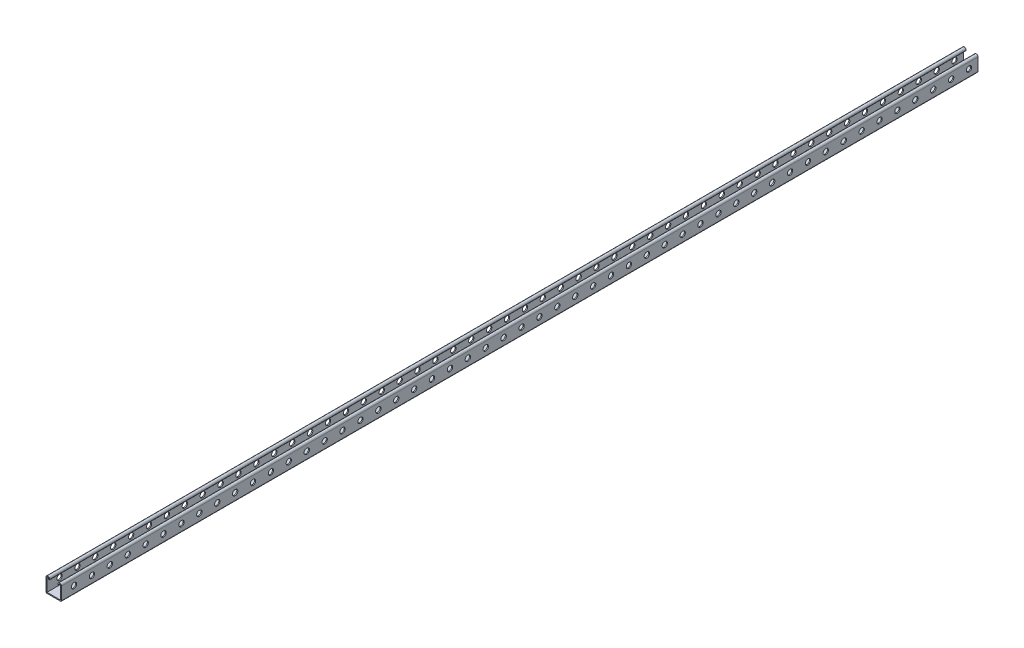
from build123d import *

# Parameters (mm, degrees)
BASE_EXTRUDE_DEPTH                         = 2438.4
HOLE1_START                                = -20.6375
HOLE1_OUTLINE_R                            = 7.14375
HOLE1_DEPTH                                = 2.6924
LPATTERN1_COUNT                            = 51
LPATTERN1_PITCH                            = 47.625
CIRPATTERN1_COUNT                          = 2
CIRPATTERN1_ANGLE                          = 90
CIRPATTERN1_START                          = -20.6375
CIRPATTERN1_COPY_1_SKETCH_R                = 7.14375
CIRPATTERN1_COPY_1_DEPTH                   = 2.6924
CIRPATTERN1_COPY_2_SKETCH_R                = 7.14375
CIRPATTERN1_COPY_2_DEPTH                   = 2.6924
CIRPATTERN1_COPY_3_SKETCH_R                = 7.14375
CIRPATTERN1_COPY_3_DEPTH                   = 2.6924
CIRPATTERN1_COPY_4_SKETCH_R                = 7.14375
CIRPATTERN1_COPY_4_DEPTH                   = 2.6924
CIRPATTERN1_COPY_5_SKETCH_R                = 7.14375
CIRPATTERN1_COPY_5_DEPTH                   = 2.6924
CIRPATTERN1_COPY_6_SKETCH_R                = 7.14375
CIRPATTERN1_COPY_6_DEPTH                   = 2.6924
CIRPATTERN1_COPY_7_SKETCH_R                = 7.14375
CIRPATTERN1_COPY_7_DEPTH                   = 2.6924
CIRPATTERN1_COPY_8_SKETCH_R                = 7.14375
CIRPATTERN1_COPY_8_DEPTH                   = 2.6924
CIRPATTERN1_COPY_9_SKETCH_R                = 7.14375
CIRPATTERN1_COPY_9_DEPTH                   = 2.6924
CIRPATTERN1_COPY_10_SKETCH_R               = 7.14375
CIRPATTERN1_COPY_10_DEPTH                  = 2.6924
CIRPATTERN1_COPY_11_SKETCH_R               = 7.14375
CIRPATTERN1_COPY_11_DEPTH                  = 2.6924
CIRPATTERN1_COPY_12_SKETCH_R               = 7.14375
CIRPATTERN1_COPY_12_DEPTH                  = 2.6924
CIRPATTERN1_COPY_13_SKETCH_R               = 7.14375
CIRPATTERN1_COPY_13_DEPTH                  = 2.6924
CIRPATTERN1_COPY_14_SKETCH_R               = 7.14375
CIRPATTERN1_COPY_14_DEPTH                  = 2.6924
CIRPATTERN1_COPY_15_SKETCH_R               = 7.14375
CIRPATTERN1_COPY_15_DEPTH                  = 2.6924
CIRPATTERN1_COPY_16_SKETCH_R               = 7.14375
CIRPATTERN1_COPY_16_DEPTH                  = 2.6924
CIRPATTERN1_COPY_17_SKETCH_R               = 7.14375
CIRPATTERN1_COPY_17_DEPTH                  = 2.6924
CIRPATTERN1_COPY_18_SKETCH_R               = 7.14375
CIRPATTERN1_COPY_18_DEPTH                  = 2.6924
CIRPATTERN1_COPY_19_SKETCH_R               = 7.14375
CIRPATTERN1_COPY_19_DEPTH                  = 2.6924
CIRPATTERN1_COPY_20_SKETCH_R               = 7.14375
CIRPATTERN1_COPY_20_DEPTH                  = 2.6924
CIRPATTERN1_COPY_21_SKETCH_R               = 7.14375
CIRPATTERN1_COPY_21_DEPTH                  = 2.6924
CIRPATTERN1_COPY_22_SKETCH_R               = 7.14375
CIRPATTERN1_COPY_22_DEPTH                  = 2.6924
CIRPATTERN1_COPY_23_SKETCH_R               = 7.14375
CIRPATTERN1_COPY_23_DEPTH                  = 2.6924
CIRPATTERN1_COPY_24_SKETCH_R               = 7.14375
CIRPATTERN1_COPY_24_DEPTH                  = 2.6924
CIRPATTERN1_COPY_25_SKETCH_R               = 7.14375
CIRPATTERN1_COPY_25_DEPTH                  = 2.6924
CIRPATTERN1_COPY_26_SKETCH_R               = 7.14375
CIRPATTERN1_COPY_26_DEPTH                  = 2.6924
CIRPATTERN1_COPY_27_SKETCH_R               = 7.14375
CIRPATTERN1_COPY_27_DEPTH                  = 2.6924
CIRPATTERN1_COPY_28_SKETCH_R               = 7.14375
CIRPATTERN1_COPY_28_DEPTH                  = 2.6924
CIRPATTERN1_COPY_29_SKETCH_R               = 7.14375
CIRPATTERN1_COPY_29_DEPTH                  = 2.6924
CIRPATTERN1_COPY_30_SKETCH_R               = 7.14375
CIRPATTERN1_COPY_30_DEPTH                  = 2.6924
CIRPATTERN1_COPY_31_SKETCH_R               = 7.14375
CIRPATTERN1_COPY_31_DEPTH                  = 2.6924
CIRPATTERN1_COPY_32_SKETCH_R               = 7.14375
CIRPATTERN1_COPY_32_DEPTH                  = 2.6924
CIRPATTERN1_COPY_33_SKETCH_R               = 7.14375
CIRPATTERN1_COPY_33_DEPTH                  = 2.6924
CIRPATTERN1_COPY_34_SKETCH_R               = 7.14375
CIRPATTERN1_COPY_34_DEPTH                  = 2.6924
CIRPATTERN1_COPY_35_SKETCH_R               = 7.14375
CIRPATTERN1_COPY_35_DEPTH                  = 2.6924
CIRPATTERN1_COPY_36_SKETCH_R               = 7.14375
CIRPATTERN1_COPY_36_DEPTH                  = 2.6924
CIRPATTERN1_COPY_37_SKETCH_R               = 7.14375
CIRPATTERN1_COPY_37_DEPTH                  = 2.6924
CIRPATTERN1_COPY_38_SKETCH_R               = 7.14375
CIRPATTERN1_COPY_38_DEPTH                  = 2.6924
CIRPATTERN1_COPY_39_SKETCH_R               = 7.14375
CIRPATTERN1_COPY_39_DEPTH                  = 2.6924
CIRPATTERN1_COPY_40_SKETCH_R               = 7.14375
CIRPATTERN1_COPY_40_DEPTH                  = 2.6924
CIRPATTERN1_COPY_41_SKETCH_R               = 7.14375
CIRPATTERN1_COPY_41_DEPTH                  = 2.6924
CIRPATTERN1_COPY_42_SKETCH_R               = 7.14375
CIRPATTERN1_COPY_42_DEPTH                  = 2.6924
CIRPATTERN1_COPY_43_SKETCH_R               = 7.14375
CIRPATTERN1_COPY_43_DEPTH                  = 2.6924
CIRPATTERN1_COPY_44_SKETCH_R               = 7.14375
CIRPATTERN1_COPY_44_DEPTH                  = 2.6924
CIRPATTERN1_COPY_45_SKETCH_R               = 7.14375
CIRPATTERN1_COPY_45_DEPTH                  = 2.6924
CIRPATTERN1_COPY_46_SKETCH_R               = 7.14375
CIRPATTERN1_COPY_46_DEPTH                  = 2.6924
CIRPATTERN1_COPY_47_SKETCH_R               = 7.14375
CIRPATTERN1_COPY_47_DEPTH                  = 2.6924
CIRPATTERN1_COPY_48_SKETCH_R               = 7.14375
CIRPATTERN1_COPY_48_DEPTH                  = 2.6924
CIRPATTERN1_COPY_49_SKETCH_R               = 7.14375
CIRPATTERN1_COPY_49_DEPTH                  = 2.6924
CIRPATTERN1_COPY_50_SKETCH_R               = 7.14375
CIRPATTERN1_COPY_50_DEPTH                  = 2.6924
CIRPATTERN1_THE_OTHER_WAY_COUNT            = 2
CIRPATTERN1_THE_OTHER_WAY_ANGLE            = 90
CIRPATTERN1_THE_OTHER_WAY_COPY_1_SKETCH_R  = 7.14375
CIRPATTERN1_THE_OTHER_WAY_COPY_1_DEPTH     = 2.6924
CIRPATTERN1_THE_OTHER_WAY_COPY_2_SKETCH_R  = 7.14375
CIRPATTERN1_THE_OTHER_WAY_COPY_2_DEPTH     = 2.6924
CIRPATTERN1_THE_OTHER_WAY_COPY_3_SKETCH_R  = 7.14375
CIRPATTERN1_THE_OTHER_WAY_COPY_3_DEPTH     = 2.6924
CIRPATTERN1_THE_OTHER_WAY_COPY_4_SKETCH_R  = 7.14375
CIRPATTERN1_THE_OTHER_WAY_COPY_4_DEPTH     = 2.6924
CIRPATTERN1_THE_OTHER_WAY_COPY_5_SKETCH_R  = 7.14375
CIRPATTERN1_THE_OTHER_WAY_COPY_5_DEPTH     = 2.6924
CIRPATTERN1_THE_OTHER_WAY_COPY_6_SKETCH_R  = 7.14375
CIRPATTERN1_THE_OTHER_WAY_COPY_6_DEPTH     = 2.6924
CIRPATTERN1_THE_OTHER_WAY_COPY_7_SKETCH_R  = 7.14375
CIRPATTERN1_THE_OTHER_WAY_COPY_7_DEPTH     = 2.6924
CIRPATTERN1_THE_OTHER_WAY_COPY_8_SKETCH_R  = 7.14375
CIRPATTERN1_THE_OTHER_WAY_COPY_8_DEPTH     = 2.6924
CIRPATTERN1_THE_OTHER_WAY_COPY_9_SKETCH_R  = 7.14375
CIRPATTERN1_THE_OTHER_WAY_COPY_9_DEPTH     = 2.6924
CIRPATTERN1_THE_OTHER_WAY_COPY_10_SKETCH_R = 7.14375
CIRPATTERN1_THE_OTHER_WAY_COPY_10_DEPTH    = 2.6924
CIRPATTERN1_THE_OTHER_WAY_COPY_11_SKETCH_R = 7.14375
CIRPATTERN1_THE_OTHER_WAY_COPY_11_DEPTH    = 2.6924
CIRPATTERN1_THE_OTHER_WAY_COPY_12_SKETCH_R = 7.14375
CIRPATTERN1_THE_OTHER_WAY_COPY_12_DEPTH    = 2.6924
CIRPATTERN1_THE_OTHER_WAY_COPY_13_SKETCH_R = 7.14375
CIRPATTERN1_THE_OTHER_WAY_COPY_13_DEPTH    = 2.6924
CIRPATTERN1_THE_OTHER_WAY_COPY_14_SKETCH_R = 7.14375
CIRPATTERN1_THE_OTHER_WAY_COPY_14_DEPTH    = 2.6924
CIRPATTERN1_THE_OTHER_WAY_COPY_15_SKETCH_R = 7.14375
CIRPATTERN1_THE_OTHER_WAY_COPY_15_DEPTH    = 2.6924
CIRPATTERN1_THE_OTHER_WAY_COPY_16_SKETCH_R = 7.14375
CIRPATTERN1_THE_OTHER_WAY_COPY_16_DEPTH    = 2.6924
CIRPATTERN1_THE_OTHER_WAY_COPY_17_SKETCH_R = 7.14375
CIRPATTERN1_THE_OTHER_WAY_COPY_17_DEPTH    = 2.6924
CIRPATTERN1_THE_OTHER_WAY_COPY_18_SKETCH_R = 7.14375
CIRPATTERN1_THE_OTHER_WAY_COPY_18_DEPTH    = 2.6924
CIRPATTERN1_THE_OTHER_WAY_COPY_19_SKETCH_R = 7.14375
CIRPATTERN1_THE_OTHER_WAY_COPY_19_DEPTH    = 2.6924
CIRPATTERN1_THE_OTHER_WAY_COPY_20_SKETCH_R = 7.14375
CIRPATTERN1_THE_OTHER_WAY_COPY_20_DEPTH    = 2.6924
CIRPATTERN1_THE_OTHER_WAY_COPY_21_SKETCH_R = 7.14375
CIRPATTERN1_THE_OTHER_WAY_COPY_21_DEPTH    = 2.6924
CIRPATTERN1_THE_OTHER_WAY_COPY_22_SKETCH_R = 7.14375
CIRPATTERN1_THE_OTHER_WAY_COPY_22_DEPTH    = 2.6924
CIRPATTERN1_THE_OTHER_WAY_COPY_23_SKETCH_R = 7.14375
CIRPATTERN1_THE_OTHER_WAY_COPY_23_DEPTH    = 2.6924
CIRPATTERN1_THE_OTHER_WAY_COPY_24_SKETCH_R = 7.14375
CIRPATTERN1_THE_OTHER_WAY_COPY_24_DEPTH    = 2.6924
CIRPATTERN1_THE_OTHER_WAY_COPY_25_SKETCH_R = 7.14375
CIRPATTERN1_THE_OTHER_WAY_COPY_25_DEPTH    = 2.6924
CIRPATTERN1_THE_OTHER_WAY_COPY_26_SKETCH_R = 7.14375
CIRPATTERN1_THE_OTHER_WAY_COPY_26_DEPTH    = 2.6924
CIRPATTERN1_THE_OTHER_WAY_COPY_27_SKETCH_R = 7.14375
CIRPATTERN1_THE_OTHER_WAY_COPY_27_DEPTH    = 2.6924
CIRPATTERN1_THE_OTHER_WAY_COPY_28_SKETCH_R = 7.14375
CIRPATTERN1_THE_OTHER_WAY_COPY_28_DEPTH    = 2.6924
CIRPATTERN1_THE_OTHER_WAY_COPY_29_SKETCH_R = 7.14375
CIRPATTERN1_THE_OTHER_WAY_COPY_29_DEPTH    = 2.6924
CIRPATTERN1_THE_OTHER_WAY_COPY_30_SKETCH_R = 7.14375
CIRPATTERN1_THE_OTHER_WAY_COPY_30_DEPTH    = 2.6924
CIRPATTERN1_THE_OTHER_WAY_COPY_31_SKETCH_R = 7.14375
CIRPATTERN1_THE_OTHER_WAY_COPY_31_DEPTH    = 2.6924
CIRPATTERN1_THE_OTHER_WAY_COPY_32_SKETCH_R = 7.14375
CIRPATTERN1_THE_OTHER_WAY_COPY_32_DEPTH    = 2.6924
CIRPATTERN1_THE_OTHER_WAY_COPY_33_SKETCH_R = 7.14375
CIRPATTERN1_THE_OTHER_WAY_COPY_33_DEPTH    = 2.6924
CIRPATTERN1_THE_OTHER_WAY_COPY_34_SKETCH_R = 7.14375
CIRPATTERN1_THE_OTHER_WAY_COPY_34_DEPTH    = 2.6924
CIRPATTERN1_THE_OTHER_WAY_COPY_35_SKETCH_R = 7.14375
CIRPATTERN1_THE_OTHER_WAY_COPY_35_DEPTH    = 2.6924
CIRPATTERN1_THE_OTHER_WAY_COPY_36_SKETCH_R = 7.14375
CIRPATTERN1_THE_OTHER_WAY_COPY_36_DEPTH    = 2.6924
CIRPATTERN1_THE_OTHER_WAY_COPY_37_SKETCH_R = 7.14375
CIRPATTERN1_THE_OTHER_WAY_COPY_37_DEPTH    = 2.6924
CIRPATTERN1_THE_OTHER_WAY_COPY_38_SKETCH_R = 7.14375
CIRPATTERN1_THE_OTHER_WAY_COPY_38_DEPTH    = 2.6924
CIRPATTERN1_THE_OTHER_WAY_COPY_39_SKETCH_R = 7.14375
CIRPATTERN1_THE_OTHER_WAY_COPY_39_DEPTH    = 2.6924
CIRPATTERN1_THE_OTHER_WAY_COPY_40_SKETCH_R = 7.14375
CIRPATTERN1_THE_OTHER_WAY_COPY_40_DEPTH    = 2.6924
CIRPATTERN1_THE_OTHER_WAY_COPY_41_SKETCH_R = 7.14375
CIRPATTERN1_THE_OTHER_WAY_COPY_41_DEPTH    = 2.6924
CIRPATTERN1_THE_OTHER_WAY_COPY_42_SKETCH_R = 7.14375
CIRPATTERN1_THE_OTHER_WAY_COPY_42_DEPTH    = 2.6924
CIRPATTERN1_THE_OTHER_WAY_COPY_43_SKETCH_R = 7.14375
CIRPATTERN1_THE_OTHER_WAY_COPY_43_DEPTH    = 2.6924
CIRPATTERN1_THE_OTHER_WAY_COPY_44_SKETCH_R = 7.14375
CIRPATTERN1_THE_OTHER_WAY_COPY_44_DEPTH    = 2.6924
CIRPATTERN1_THE_OTHER_WAY_COPY_45_SKETCH_R = 7.14375
CIRPATTERN1_THE_OTHER_WAY_COPY_45_DEPTH    = 2.6924
CIRPATTERN1_THE_OTHER_WAY_COPY_46_SKETCH_R = 7.14375
CIRPATTERN1_THE_OTHER_WAY_COPY_46_DEPTH    = 2.6924
CIRPATTERN1_THE_OTHER_WAY_COPY_47_SKETCH_R = 7.14375
CIRPATTERN1_THE_OTHER_WAY_COPY_47_DEPTH    = 2.6924
CIRPATTERN1_THE_OTHER_WAY_COPY_48_SKETCH_R = 7.14375
CIRPATTERN1_THE_OTHER_WAY_COPY_48_DEPTH    = 2.6924
CIRPATTERN1_THE_OTHER_WAY_COPY_49_SKETCH_R = 7.14375
CIRPATTERN1_THE_OTHER_WAY_COPY_49_DEPTH    = 2.6924
CIRPATTERN1_THE_OTHER_WAY_COPY_50_SKETCH_R = 7.14375
CIRPATTERN1_THE_OTHER_WAY_COPY_50_DEPTH    = 2.6924


# Read off the part's stored shape, not the designer's step: Hole1
with BuildPart() as part:
    # Sketch1 → Base-Extrude (new body)
    with BuildSketch(Plane.XY):
        with BuildLine():
            Line((-20.6375, 15.875), (-20.6375, -17.9451))
            ThreePointArc((-20.6375, -17.9451), (-19.848914298, -19.848914298), (-17.9451, -20.6375))
            Line((-17.9451, -20.6375), (17.9451, -20.6375))
            ThreePointArc((17.9451, -20.6375), (19.848914298, -19.848914298), (20.6375, -17.9451))
            Line((20.6375, -17.9451), (20.6375, 15.875))
            ThreePointArc((20.6375, 15.875), (15.875, 20.6375), (11.1125, 15.875))
            Line((11.1125, 15.875), (11.1125, 14.83995))
            ThreePointArc((11.1125, 14.83995), (12.4587, 13.49375), (13.8049, 14.83995))
            Line((13.8049, 14.83995), (13.8049, 15.875))
            ThreePointArc((13.8049, 15.875), (15.875, 17.9451), (17.9451, 15.875))
            Line((17.9451, 15.875), (17.9451, -17.9451))
            Line((17.9451, -17.9451), (-17.9451, -17.9451))
            Line((-17.9451, -17.9451), (-17.9451, 15.875))
            ThreePointArc((-17.9451, 15.875), (-15.875, 17.9451), (-13.8049, 15.875))
            Line((-13.8049, 15.875), (-13.8049, 14.83995))
            ThreePointArc((-13.8049, 14.83995), (-12.4587, 13.49375), (-11.1125, 14.83995))
            Line((-11.1125, 14.83995), (-11.1125, 15.875))
            ThreePointArc((-11.1125, 15.875), (-15.875, 20.6375), (-20.6375, 15.875))
        make_face()
    extrude(amount=BASE_EXTRUDE_DEPTH)

    # Hole1 outline → Hole1 (cut)
    with BuildSketch(Plane(origin=(0, 0, 0), x_dir=(1, 0, 0), z_dir=(0, 1, 0)).offset(HOLE1_START)):
        with Locations((0, -23.8125)):
            Circle(HOLE1_OUTLINE_R)
    hole1 = extrude(amount=HOLE1_DEPTH, mode=Mode.SUBTRACT)

    # LPattern1: Hole1 ×51
    with Locations(*[(0, 0, i * LPATTERN1_PITCH) for i in range(1, LPATTERN1_COUNT)]):
        add(hole1, mode=Mode.SUBTRACT)

    # CirPattern1: Hole1 ×2 about axis
    cirpattern1_axis = Axis((0, 0, -50), (0, 0, 1))
    for i in range(1, CIRPATTERN1_COUNT):
        add(hole1.rotate(cirpattern1_axis, i * CIRPATTERN1_ANGLE / (CIRPATTERN1_COUNT - 1)), mode=Mode.SUBTRACT)

    # CirPattern1 copy 1 sketch → CirPattern1 copy 1 (cut)
    with BuildSketch(Plane(origin=(0, 0, 47.625), x_dir=(0, 1, 0), z_dir=(-1, 0, 0)).offset(CIRPATTERN1_START)):
        with Locations((0, -23.8125)):
            Circle(CIRPATTERN1_COPY_1_SKETCH_R)
    extrude(amount=CIRPATTERN1_COPY_1_DEPTH, mode=Mode.SUBTRACT)

    # CirPattern1 copy 2 sketch → CirPattern1 copy 2 (cut)
    with BuildSketch(Plane(origin=(0, 0, 95.25), x_dir=(0, 1, 0), z_dir=(-1, 0, 0)).offset(CIRPATTERN1_START)):
        with Locations((0, -23.8125)):
            Circle(CIRPATTERN1_COPY_2_SKETCH_R)
    extrude(amount=CIRPATTERN1_COPY_2_DEPTH, mode=Mode.SUBTRACT)

    # CirPattern1 copy 3 sketch → CirPattern1 copy 3 (cut)
    with BuildSketch(Plane(origin=(0, 0, 142.875), x_dir=(0, 1, 0), z_dir=(-1, 0, 0)).offset(CIRPATTERN1_START)):
        with Locations((0, -23.8125)):
            Circle(CIRPATTERN1_COPY_3_SKETCH_R)
    extrude(amount=CIRPATTERN1_COPY_3_DEPTH, mode=Mode.SUBTRACT)

    # CirPattern1 copy 4 sketch → CirPattern1 copy 4 (cut)
    with BuildSketch(Plane(origin=(0, 0, 190.5), x_dir=(0, 1, 0), z_dir=(-1, 0, 0)).offset(CIRPATTERN1_START)):
        with Locations((0, -23.8125)):
            Circle(CIRPATTERN1_COPY_4_SKETCH_R)
    extrude(amount=CIRPATTERN1_COPY_4_DEPTH, mode=Mode.SUBTRACT)

    # CirPattern1 copy 5 sketch → CirPattern1 copy 5 (cut)
    with BuildSketch(Plane(origin=(0, 0, 238.125), x_dir=(0, 1, 0), z_dir=(-1, 0, 0)).offset(CIRPATTERN1_START)):
        with Locations((0, -23.8125)):
            Circle(CIRPATTERN1_COPY_5_SKETCH_R)
    extrude(amount=CIRPATTERN1_COPY_5_DEPTH, mode=Mode.SUBTRACT)

    # CirPattern1 copy 6 sketch → CirPattern1 copy 6 (cut)
    with BuildSketch(Plane(origin=(0, 0, 285.75), x_dir=(0, 1, 0), z_dir=(-1, 0, 0)).offset(CIRPATTERN1_START)):
        with Locations((0, -23.8125)):
            Circle(CIRPATTERN1_COPY_6_SKETCH_R)
    extrude(amount=CIRPATTERN1_COPY_6_DEPTH, mode=Mode.SUBTRACT)

    # CirPattern1 copy 7 sketch → CirPattern1 copy 7 (cut)
    with BuildSketch(Plane(origin=(0, 0, 333.375), x_dir=(0, 1, 0), z_dir=(-1, 0, 0)).offset(CIRPATTERN1_START)):
        with Locations((0, -23.8125)):
            Circle(CIRPATTERN1_COPY_7_SKETCH_R)
    extrude(amount=CIRPATTERN1_COPY_7_DEPTH, mode=Mode.SUBTRACT)

    # CirPattern1 copy 8 sketch → CirPattern1 copy 8 (cut)
    with BuildSketch(Plane(origin=(0, 0, 381), x_dir=(0, 1, 0), z_dir=(-1, 0, 0)).offset(CIRPATTERN1_START)):
        with Locations((0, -23.8125)):
            Circle(CIRPATTERN1_COPY_8_SKETCH_R)
    extrude(amount=CIRPATTERN1_COPY_8_DEPTH, mode=Mode.SUBTRACT)

    # CirPattern1 copy 9 sketch → CirPattern1 copy 9 (cut)
    with BuildSketch(Plane(origin=(0, 0, 428.625), x_dir=(0, 1, 0), z_dir=(-1, 0, 0)).offset(CIRPATTERN1_START)):
        with Locations((0, -23.8125)):
            Circle(CIRPATTERN1_COPY_9_SKETCH_R)
    extrude(amount=CIRPATTERN1_COPY_9_DEPTH, mode=Mode.SUBTRACT)

    # CirPattern1 copy 10 sketch → CirPattern1 copy 10 (cut)
    with BuildSketch(Plane(origin=(0, 0, 476.25), x_dir=(0, 1, 0), z_dir=(-1, 0, 0)).offset(CIRPATTERN1_START)):
        with Locations((0, -23.8125)):
            Circle(CIRPATTERN1_COPY_10_SKETCH_R)
    extrude(amount=CIRPATTERN1_COPY_10_DEPTH, mode=Mode.SUBTRACT)

    # CirPattern1 copy 11 sketch → CirPattern1 copy 11 (cut)
    with BuildSketch(Plane(origin=(0, 0, 523.875), x_dir=(0, 1, 0), z_dir=(-1, 0, 0)).offset(CIRPATTERN1_START)):
        with Locations((0, -23.8125)):
            Circle(CIRPATTERN1_COPY_11_SKETCH_R)
    extrude(amount=CIRPATTERN1_COPY_11_DEPTH, mode=Mode.SUBTRACT)

    # CirPattern1 copy 12 sketch → CirPattern1 copy 12 (cut)
    with BuildSketch(Plane(origin=(0, 0, 571.5), x_dir=(0, 1, 0), z_dir=(-1, 0, 0)).offset(CIRPATTERN1_START)):
        with Locations((0, -23.8125)):
            Circle(CIRPATTERN1_COPY_12_SKETCH_R)
    extrude(amount=CIRPATTERN1_COPY_12_DEPTH, mode=Mode.SUBTRACT)

    # CirPattern1 copy 13 sketch → CirPattern1 copy 13 (cut)
    with BuildSketch(Plane(origin=(0, 0, 619.125), x_dir=(0, 1, 0), z_dir=(-1, 0, 0)).offset(CIRPATTERN1_START)):
        with Locations((0, -23.8125)):
            Circle(CIRPATTERN1_COPY_13_SKETCH_R)
    extrude(amount=CIRPATTERN1_COPY_13_DEPTH, mode=Mode.SUBTRACT)

    # CirPattern1 copy 14 sketch → CirPattern1 copy 14 (cut)
    with BuildSketch(Plane(origin=(0, 0, 666.75), x_dir=(0, 1, 0), z_dir=(-1, 0, 0)).offset(CIRPATTERN1_START)):
        with Locations((0, -23.8125)):
            Circle(CIRPATTERN1_COPY_14_SKETCH_R)
    extrude(amount=CIRPATTERN1_COPY_14_DEPTH, mode=Mode.SUBTRACT)

    # CirPattern1 copy 15 sketch → CirPattern1 copy 15 (cut)
    with BuildSketch(Plane(origin=(0, 0, 714.375), x_dir=(0, 1, 0), z_dir=(-1, 0, 0)).offset(CIRPATTERN1_START)):
        with Locations((0, -23.8125)):
            Circle(CIRPATTERN1_COPY_15_SKETCH_R)
    extrude(amount=CIRPATTERN1_COPY_15_DEPTH, mode=Mode.SUBTRACT)

    # CirPattern1 copy 16 sketch → CirPattern1 copy 16 (cut)
    with BuildSketch(Plane(origin=(0, 0, 762), x_dir=(0, 1, 0), z_dir=(-1, 0, 0)).offset(CIRPATTERN1_START)):
        with Locations((0, -23.8125)):
            Circle(CIRPATTERN1_COPY_16_SKETCH_R)
    extrude(amount=CIRPATTERN1_COPY_16_DEPTH, mode=Mode.SUBTRACT)

    # CirPattern1 copy 17 sketch → CirPattern1 copy 17 (cut)
    with BuildSketch(Plane(origin=(0, 0, 809.625), x_dir=(0, 1, 0), z_dir=(-1, 0, 0)).offset(CIRPATTERN1_START)):
        with Locations((0, -23.8125)):
            Circle(CIRPATTERN1_COPY_17_SKETCH_R)
    extrude(amount=CIRPATTERN1_COPY_17_DEPTH, mode=Mode.SUBTRACT)

    # CirPattern1 copy 18 sketch → CirPattern1 copy 18 (cut)
    with BuildSketch(Plane(origin=(0, 0, 857.25), x_dir=(0, 1, 0), z_dir=(-1, 0, 0)).offset(CIRPATTERN1_START)):
        with Locations((0, -23.8125)):
            Circle(CIRPATTERN1_COPY_18_SKETCH_R)
    extrude(amount=CIRPATTERN1_COPY_18_DEPTH, mode=Mode.SUBTRACT)

    # CirPattern1 copy 19 sketch → CirPattern1 copy 19 (cut)
    with BuildSketch(Plane(origin=(0, 0, 904.875), x_dir=(0, 1, 0), z_dir=(-1, 0, 0)).offset(CIRPATTERN1_START)):
        with Locations((0, -23.8125)):
            Circle(CIRPATTERN1_COPY_19_SKETCH_R)
    extrude(amount=CIRPATTERN1_COPY_19_DEPTH, mode=Mode.SUBTRACT)

    # CirPattern1 copy 20 sketch → CirPattern1 copy 20 (cut)
    with BuildSketch(Plane(origin=(0, 0, 952.5), x_dir=(0, 1, 0), z_dir=(-1, 0, 0)).offset(CIRPATTERN1_START)):
        with Locations((0, -23.8125)):
            Circle(CIRPATTERN1_COPY_20_SKETCH_R)
    extrude(amount=CIRPATTERN1_COPY_20_DEPTH, mode=Mode.SUBTRACT)

    # CirPattern1 copy 21 sketch → CirPattern1 copy 21 (cut)
    with BuildSketch(Plane(origin=(0, 0, 1000.125), x_dir=(0, 1, 0), z_dir=(-1, 0, 0)).offset(CIRPATTERN1_START)):
        with Locations((0, -23.8125)):
            Circle(CIRPATTERN1_COPY_21_SKETCH_R)
    extrude(amount=CIRPATTERN1_COPY_21_DEPTH, mode=Mode.SUBTRACT)

    # CirPattern1 copy 22 sketch → CirPattern1 copy 22 (cut)
    with BuildSketch(Plane(origin=(0, 0, 1047.75), x_dir=(0, 1, 0), z_dir=(-1, 0, 0)).offset(CIRPATTERN1_START)):
        with Locations((0, -23.8125)):
            Circle(CIRPATTERN1_COPY_22_SKETCH_R)
    extrude(amount=CIRPATTERN1_COPY_22_DEPTH, mode=Mode.SUBTRACT)

    # CirPattern1 copy 23 sketch → CirPattern1 copy 23 (cut)
    with BuildSketch(Plane(origin=(0, 0, 1095.375), x_dir=(0, 1, 0), z_dir=(-1, 0, 0)).offset(CIRPATTERN1_START)):
        with Locations((0, -23.8125)):
            Circle(CIRPATTERN1_COPY_23_SKETCH_R)
    extrude(amount=CIRPATTERN1_COPY_23_DEPTH, mode=Mode.SUBTRACT)

    # CirPattern1 copy 24 sketch → CirPattern1 copy 24 (cut)
    with BuildSketch(Plane(origin=(0, 0, 1143), x_dir=(0, 1, 0), z_dir=(-1, 0, 0)).offset(CIRPATTERN1_START)):
        with Locations((0, -23.8125)):
            Circle(CIRPATTERN1_COPY_24_SKETCH_R)
    extrude(amount=CIRPATTERN1_COPY_24_DEPTH, mode=Mode.SUBTRACT)

    # CirPattern1 copy 25 sketch → CirPattern1 copy 25 (cut)
    with BuildSketch(Plane(origin=(0, 0, 1190.625), x_dir=(0, 1, 0), z_dir=(-1, 0, 0)).offset(CIRPATTERN1_START)):
        with Locations((0, -23.8125)):
            Circle(CIRPATTERN1_COPY_25_SKETCH_R)
    extrude(amount=CIRPATTERN1_COPY_25_DEPTH, mode=Mode.SUBTRACT)

    # CirPattern1 copy 26 sketch → CirPattern1 copy 26 (cut)
    with BuildSketch(Plane(origin=(0, 0, 1238.25), x_dir=(0, 1, 0), z_dir=(-1, 0, 0)).offset(CIRPATTERN1_START)):
        with Locations((0, -23.8125)):
            Circle(CIRPATTERN1_COPY_26_SKETCH_R)
    extrude(amount=CIRPATTERN1_COPY_26_DEPTH, mode=Mode.SUBTRACT)

    # CirPattern1 copy 27 sketch → CirPattern1 copy 27 (cut)
    with BuildSketch(Plane(origin=(0, 0, 1285.875), x_dir=(0, 1, 0), z_dir=(-1, 0, 0)).offset(CIRPATTERN1_START)):
        with Locations((0, -23.8125)):
            Circle(CIRPATTERN1_COPY_27_SKETCH_R)
    extrude(amount=CIRPATTERN1_COPY_27_DEPTH, mode=Mode.SUBTRACT)

    # CirPattern1 copy 28 sketch → CirPattern1 copy 28 (cut)
    with BuildSketch(Plane(origin=(0, 0, 1333.5), x_dir=(0, 1, 0), z_dir=(-1, 0, 0)).offset(CIRPATTERN1_START)):
        with Locations((0, -23.8125)):
            Circle(CIRPATTERN1_COPY_28_SKETCH_R)
    extrude(amount=CIRPATTERN1_COPY_28_DEPTH, mode=Mode.SUBTRACT)

    # CirPattern1 copy 29 sketch → CirPattern1 copy 29 (cut)
    with BuildSketch(Plane(origin=(0, 0, 1381.125), x_dir=(0, 1, 0), z_dir=(-1, 0, 0)).offset(CIRPATTERN1_START)):
        with Locations((0, -23.8125)):
            Circle(CIRPATTERN1_COPY_29_SKETCH_R)
    extrude(amount=CIRPATTERN1_COPY_29_DEPTH, mode=Mode.SUBTRACT)

    # CirPattern1 copy 30 sketch → CirPattern1 copy 30 (cut)
    with BuildSketch(Plane(origin=(0, 0, 1428.75), x_dir=(0, 1, 0), z_dir=(-1, 0, 0)).offset(CIRPATTERN1_START)):
        with Locations((0, -23.8125)):
            Circle(CIRPATTERN1_COPY_30_SKETCH_R)
    extrude(amount=CIRPATTERN1_COPY_30_DEPTH, mode=Mode.SUBTRACT)

    # CirPattern1 copy 31 sketch → CirPattern1 copy 31 (cut)
    with BuildSketch(Plane(origin=(0, 0, 1476.375), x_dir=(0, 1, 0), z_dir=(-1, 0, 0)).offset(CIRPATTERN1_START)):
        with Locations((0, -23.8125)):
            Circle(CIRPATTERN1_COPY_31_SKETCH_R)
    extrude(amount=CIRPATTERN1_COPY_31_DEPTH, mode=Mode.SUBTRACT)

    # CirPattern1 copy 32 sketch → CirPattern1 copy 32 (cut)
    with BuildSketch(Plane(origin=(0, 0, 1524), x_dir=(0, 1, 0), z_dir=(-1, 0, 0)).offset(CIRPATTERN1_START)):
        with Locations((0, -23.8125)):
            Circle(CIRPATTERN1_COPY_32_SKETCH_R)
    extrude(amount=CIRPATTERN1_COPY_32_DEPTH, mode=Mode.SUBTRACT)

    # CirPattern1 copy 33 sketch → CirPattern1 copy 33 (cut)
    with BuildSketch(Plane(origin=(0, 0, 1571.625), x_dir=(0, 1, 0), z_dir=(-1, 0, 0)).offset(CIRPATTERN1_START)):
        with Locations((0, -23.8125)):
            Circle(CIRPATTERN1_COPY_33_SKETCH_R)
    extrude(amount=CIRPATTERN1_COPY_33_DEPTH, mode=Mode.SUBTRACT)

    # CirPattern1 copy 34 sketch → CirPattern1 copy 34 (cut)
    with BuildSketch(Plane(origin=(0, 0, 1619.25), x_dir=(0, 1, 0), z_dir=(-1, 0, 0)).offset(CIRPATTERN1_START)):
        with Locations((0, -23.8125)):
            Circle(CIRPATTERN1_COPY_34_SKETCH_R)
    extrude(amount=CIRPATTERN1_COPY_34_DEPTH, mode=Mode.SUBTRACT)

    # CirPattern1 copy 35 sketch → CirPattern1 copy 35 (cut)
    with BuildSketch(Plane(origin=(0, 0, 1666.875), x_dir=(0, 1, 0), z_dir=(-1, 0, 0)).offset(CIRPATTERN1_START)):
        with Locations((0, -23.8125)):
            Circle(CIRPATTERN1_COPY_35_SKETCH_R)
    extrude(amount=CIRPATTERN1_COPY_35_DEPTH, mode=Mode.SUBTRACT)

    # CirPattern1 copy 36 sketch → CirPattern1 copy 36 (cut)
    with BuildSketch(Plane(origin=(0, 0, 1714.5), x_dir=(0, 1, 0), z_dir=(-1, 0, 0)).offset(CIRPATTERN1_START)):
        with Locations((0, -23.8125)):
            Circle(CIRPATTERN1_COPY_36_SKETCH_R)
    extrude(amount=CIRPATTERN1_COPY_36_DEPTH, mode=Mode.SUBTRACT)

    # CirPattern1 copy 37 sketch → CirPattern1 copy 37 (cut)
    with BuildSketch(Plane(origin=(0, 0, 1762.125), x_dir=(0, 1, 0), z_dir=(-1, 0, 0)).offset(CIRPATTERN1_START)):
        with Locations((0, -23.8125)):
            Circle(CIRPATTERN1_COPY_37_SKETCH_R)
    extrude(amount=CIRPATTERN1_COPY_37_DEPTH, mode=Mode.SUBTRACT)

    # CirPattern1 copy 38 sketch → CirPattern1 copy 38 (cut)
    with BuildSketch(Plane(origin=(0, 0, 1809.75), x_dir=(0, 1, 0), z_dir=(-1, 0, 0)).offset(CIRPATTERN1_START)):
        with Locations((0, -23.8125)):
            Circle(CIRPATTERN1_COPY_38_SKETCH_R)
    extrude(amount=CIRPATTERN1_COPY_38_DEPTH, mode=Mode.SUBTRACT)

    # CirPattern1 copy 39 sketch → CirPattern1 copy 39 (cut)
    with BuildSketch(Plane(origin=(0, 0, 1857.375), x_dir=(0, 1, 0), z_dir=(-1, 0, 0)).offset(CIRPATTERN1_START)):
        with Locations((0, -23.8125)):
            Circle(CIRPATTERN1_COPY_39_SKETCH_R)
    extrude(amount=CIRPATTERN1_COPY_39_DEPTH, mode=Mode.SUBTRACT)

    # CirPattern1 copy 40 sketch → CirPattern1 copy 40 (cut)
    with BuildSketch(Plane(origin=(0, 0, 1905), x_dir=(0, 1, 0), z_dir=(-1, 0, 0)).offset(CIRPATTERN1_START)):
        with Locations((0, -23.8125)):
            Circle(CIRPATTERN1_COPY_40_SKETCH_R)
    extrude(amount=CIRPATTERN1_COPY_40_DEPTH, mode=Mode.SUBTRACT)

    # CirPattern1 copy 41 sketch → CirPattern1 copy 41 (cut)
    with BuildSketch(Plane(origin=(0, 0, 1952.625), x_dir=(0, 1, 0), z_dir=(-1, 0, 0)).offset(CIRPATTERN1_START)):
        with Locations((0, -23.8125)):
            Circle(CIRPATTERN1_COPY_41_SKETCH_R)
    extrude(amount=CIRPATTERN1_COPY_41_DEPTH, mode=Mode.SUBTRACT)

    # CirPattern1 copy 42 sketch → CirPattern1 copy 42 (cut)
    with BuildSketch(Plane(origin=(0, 0, 2000.25), x_dir=(0, 1, 0), z_dir=(-1, 0, 0)).offset(CIRPATTERN1_START)):
        with Locations((0, -23.8125)):
            Circle(CIRPATTERN1_COPY_42_SKETCH_R)
    extrude(amount=CIRPATTERN1_COPY_42_DEPTH, mode=Mode.SUBTRACT)

    # CirPattern1 copy 43 sketch → CirPattern1 copy 43 (cut)
    with BuildSketch(Plane(origin=(0, 0, 2047.875), x_dir=(0, 1, 0), z_dir=(-1, 0, 0)).offset(CIRPATTERN1_START)):
        with Locations((0, -23.8125)):
            Circle(CIRPATTERN1_COPY_43_SKETCH_R)
    extrude(amount=CIRPATTERN1_COPY_43_DEPTH, mode=Mode.SUBTRACT)

    # CirPattern1 copy 44 sketch → CirPattern1 copy 44 (cut)
    with BuildSketch(Plane(origin=(0, 0, 2095.5), x_dir=(0, 1, 0), z_dir=(-1, 0, 0)).offset(CIRPATTERN1_START)):
        with Locations((0, -23.8125)):
            Circle(CIRPATTERN1_COPY_44_SKETCH_R)
    extrude(amount=CIRPATTERN1_COPY_44_DEPTH, mode=Mode.SUBTRACT)

    # CirPattern1 copy 45 sketch → CirPattern1 copy 45 (cut)
    with BuildSketch(Plane(origin=(0, 0, 2143.125), x_dir=(0, 1, 0), z_dir=(-1, 0, 0)).offset(CIRPATTERN1_START)):
        with Locations((0, -23.8125)):
            Circle(CIRPATTERN1_COPY_45_SKETCH_R)
    extrude(amount=CIRPATTERN1_COPY_45_DEPTH, mode=Mode.SUBTRACT)

    # CirPattern1 copy 46 sketch → CirPattern1 copy 46 (cut)
    with BuildSketch(Plane(origin=(0, 0, 2190.75), x_dir=(0, 1, 0), z_dir=(-1, 0, 0)).offset(CIRPATTERN1_START)):
        with Locations((0, -23.8125)):
            Circle(CIRPATTERN1_COPY_46_SKETCH_R)
    extrude(amount=CIRPATTERN1_COPY_46_DEPTH, mode=Mode.SUBTRACT)

    # CirPattern1 copy 47 sketch → CirPattern1 copy 47 (cut)
    with BuildSketch(Plane(origin=(0, 0, 2238.375), x_dir=(0, 1, 0), z_dir=(-1, 0, 0)).offset(CIRPATTERN1_START)):
        with Locations((0, -23.8125)):
            Circle(CIRPATTERN1_COPY_47_SKETCH_R)
    extrude(amount=CIRPATTERN1_COPY_47_DEPTH, mode=Mode.SUBTRACT)

    # CirPattern1 copy 48 sketch → CirPattern1 copy 48 (cut)
    with BuildSketch(Plane(origin=(0, 0, 2286), x_dir=(0, 1, 0), z_dir=(-1, 0, 0)).offset(CIRPATTERN1_START)):
        with Locations((0, -23.8125)):
            Circle(CIRPATTERN1_COPY_48_SKETCH_R)
    extrude(amount=CIRPATTERN1_COPY_48_DEPTH, mode=Mode.SUBTRACT)

    # CirPattern1 copy 49 sketch → CirPattern1 copy 49 (cut)
    with BuildSketch(Plane(origin=(0, 0, 2333.625), x_dir=(0, 1, 0), z_dir=(-1, 0, 0)).offset(CIRPATTERN1_START)):
        with Locations((0, -23.8125)):
            Circle(CIRPATTERN1_COPY_49_SKETCH_R)
    extrude(amount=CIRPATTERN1_COPY_49_DEPTH, mode=Mode.SUBTRACT)

    # CirPattern1 copy 50 sketch → CirPattern1 copy 50 (cut)
    with BuildSketch(Plane(origin=(0, 0, 2381.25), x_dir=(0, 1, 0), z_dir=(-1, 0, 0)).offset(CIRPATTERN1_START)):
        with Locations((0, -23.8125)):
            Circle(CIRPATTERN1_COPY_50_SKETCH_R)
    extrude(amount=CIRPATTERN1_COPY_50_DEPTH, mode=Mode.SUBTRACT)

    # CirPattern1 the other way: Hole1 ×2 about axis
    cirpattern1_the_other_way_axis = Axis((0, 0, -50), (0, 0, -1))
    for i in range(1, CIRPATTERN1_THE_OTHER_WAY_COUNT):
        add(hole1.rotate(cirpattern1_the_other_way_axis, i * CIRPATTERN1_THE_OTHER_WAY_ANGLE / (CIRPATTERN1_THE_OTHER_WAY_COUNT - 1)), mode=Mode.SUBTRACT)

    # CirPattern1 the other way copy 1 sketch → CirPattern1 the other way copy 1 (cut)
    with BuildSketch(Plane(origin=(0, 0, 47.625), x_dir=(0, -1, 0), z_dir=(1, 0, 0)).offset(CIRPATTERN1_START)):
        with Locations((0, -23.8125)):
            Circle(CIRPATTERN1_THE_OTHER_WAY_COPY_1_SKETCH_R)
    extrude(amount=CIRPATTERN1_THE_OTHER_WAY_COPY_1_DEPTH, mode=Mode.SUBTRACT)

    # CirPattern1 the other way copy 2 sketch → CirPattern1 the other way copy 2 (cut)
    with BuildSketch(Plane(origin=(0, 0, 95.25), x_dir=(0, -1, 0), z_dir=(1, 0, 0)).offset(CIRPATTERN1_START)):
        with Locations((0, -23.8125)):
            Circle(CIRPATTERN1_THE_OTHER_WAY_COPY_2_SKETCH_R)
    extrude(amount=CIRPATTERN1_THE_OTHER_WAY_COPY_2_DEPTH, mode=Mode.SUBTRACT)

    # CirPattern1 the other way copy 3 sketch → CirPattern1 the other way copy 3 (cut)
    with BuildSketch(Plane(origin=(0, 0, 142.875), x_dir=(0, -1, 0), z_dir=(1, 0, 0)).offset(CIRPATTERN1_START)):
        with Locations((0, -23.8125)):
            Circle(CIRPATTERN1_THE_OTHER_WAY_COPY_3_SKETCH_R)
    extrude(amount=CIRPATTERN1_THE_OTHER_WAY_COPY_3_DEPTH, mode=Mode.SUBTRACT)

    # CirPattern1 the other way copy 4 sketch → CirPattern1 the other way copy 4 (cut)
    with BuildSketch(Plane(origin=(0, 0, 190.5), x_dir=(0, -1, 0), z_dir=(1, 0, 0)).offset(CIRPATTERN1_START)):
        with Locations((0, -23.8125)):
            Circle(CIRPATTERN1_THE_OTHER_WAY_COPY_4_SKETCH_R)
    extrude(amount=CIRPATTERN1_THE_OTHER_WAY_COPY_4_DEPTH, mode=Mode.SUBTRACT)

    # CirPattern1 the other way copy 5 sketch → CirPattern1 the other way copy 5 (cut)
    with BuildSketch(Plane(origin=(0, 0, 238.125), x_dir=(0, -1, 0), z_dir=(1, 0, 0)).offset(CIRPATTERN1_START)):
        with Locations((0, -23.8125)):
            Circle(CIRPATTERN1_THE_OTHER_WAY_COPY_5_SKETCH_R)
    extrude(amount=CIRPATTERN1_THE_OTHER_WAY_COPY_5_DEPTH, mode=Mode.SUBTRACT)

    # CirPattern1 the other way copy 6 sketch → CirPattern1 the other way copy 6 (cut)
    with BuildSketch(Plane(origin=(0, 0, 285.75), x_dir=(0, -1, 0), z_dir=(1, 0, 0)).offset(CIRPATTERN1_START)):
        with Locations((0, -23.8125)):
            Circle(CIRPATTERN1_THE_OTHER_WAY_COPY_6_SKETCH_R)
    extrude(amount=CIRPATTERN1_THE_OTHER_WAY_COPY_6_DEPTH, mode=Mode.SUBTRACT)

    # CirPattern1 the other way copy 7 sketch → CirPattern1 the other way copy 7 (cut)
    with BuildSketch(Plane(origin=(0, 0, 333.375), x_dir=(0, -1, 0), z_dir=(1, 0, 0)).offset(CIRPATTERN1_START)):
        with Locations((0, -23.8125)):
            Circle(CIRPATTERN1_THE_OTHER_WAY_COPY_7_SKETCH_R)
    extrude(amount=CIRPATTERN1_THE_OTHER_WAY_COPY_7_DEPTH, mode=Mode.SUBTRACT)

    # CirPattern1 the other way copy 8 sketch → CirPattern1 the other way copy 8 (cut)
    with BuildSketch(Plane(origin=(0, 0, 381), x_dir=(0, -1, 0), z_dir=(1, 0, 0)).offset(CIRPATTERN1_START)):
        with Locations((0, -23.8125)):
            Circle(CIRPATTERN1_THE_OTHER_WAY_COPY_8_SKETCH_R)
    extrude(amount=CIRPATTERN1_THE_OTHER_WAY_COPY_8_DEPTH, mode=Mode.SUBTRACT)

    # CirPattern1 the other way copy 9 sketch → CirPattern1 the other way copy 9 (cut)
    with BuildSketch(Plane(origin=(0, 0, 428.625), x_dir=(0, -1, 0), z_dir=(1, 0, 0)).offset(CIRPATTERN1_START)):
        with Locations((0, -23.8125)):
            Circle(CIRPATTERN1_THE_OTHER_WAY_COPY_9_SKETCH_R)
    extrude(amount=CIRPATTERN1_THE_OTHER_WAY_COPY_9_DEPTH, mode=Mode.SUBTRACT)

    # CirPattern1 the other way copy 10 sketch → CirPattern1 the other way copy 10 (cut)
    with BuildSketch(Plane(origin=(0, 0, 476.25), x_dir=(0, -1, 0), z_dir=(1, 0, 0)).offset(CIRPATTERN1_START)):
        with Locations((0, -23.8125)):
            Circle(CIRPATTERN1_THE_OTHER_WAY_COPY_10_SKETCH_R)
    extrude(amount=CIRPATTERN1_THE_OTHER_WAY_COPY_10_DEPTH, mode=Mode.SUBTRACT)

    # CirPattern1 the other way copy 11 sketch → CirPattern1 the other way copy 11 (cut)
    with BuildSketch(Plane(origin=(0, 0, 523.875), x_dir=(0, -1, 0), z_dir=(1, 0, 0)).offset(CIRPATTERN1_START)):
        with Locations((0, -23.8125)):
            Circle(CIRPATTERN1_THE_OTHER_WAY_COPY_11_SKETCH_R)
    extrude(amount=CIRPATTERN1_THE_OTHER_WAY_COPY_11_DEPTH, mode=Mode.SUBTRACT)

    # CirPattern1 the other way copy 12 sketch → CirPattern1 the other way copy 12 (cut)
    with BuildSketch(Plane(origin=(0, 0, 571.5), x_dir=(0, -1, 0), z_dir=(1, 0, 0)).offset(CIRPATTERN1_START)):
        with Locations((0, -23.8125)):
            Circle(CIRPATTERN1_THE_OTHER_WAY_COPY_12_SKETCH_R)
    extrude(amount=CIRPATTERN1_THE_OTHER_WAY_COPY_12_DEPTH, mode=Mode.SUBTRACT)

    # CirPattern1 the other way copy 13 sketch → CirPattern1 the other way copy 13 (cut)
    with BuildSketch(Plane(origin=(0, 0, 619.125), x_dir=(0, -1, 0), z_dir=(1, 0, 0)).offset(CIRPATTERN1_START)):
        with Locations((0, -23.8125)):
            Circle(CIRPATTERN1_THE_OTHER_WAY_COPY_13_SKETCH_R)
    extrude(amount=CIRPATTERN1_THE_OTHER_WAY_COPY_13_DEPTH, mode=Mode.SUBTRACT)

    # CirPattern1 the other way copy 14 sketch → CirPattern1 the other way copy 14 (cut)
    with BuildSketch(Plane(origin=(0, 0, 666.75), x_dir=(0, -1, 0), z_dir=(1, 0, 0)).offset(CIRPATTERN1_START)):
        with Locations((0, -23.8125)):
            Circle(CIRPATTERN1_THE_OTHER_WAY_COPY_14_SKETCH_R)
    extrude(amount=CIRPATTERN1_THE_OTHER_WAY_COPY_14_DEPTH, mode=Mode.SUBTRACT)

    # CirPattern1 the other way copy 15 sketch → CirPattern1 the other way copy 15 (cut)
    with BuildSketch(Plane(origin=(0, 0, 714.375), x_dir=(0, -1, 0), z_dir=(1, 0, 0)).offset(CIRPATTERN1_START)):
        with Locations((0, -23.8125)):
            Circle(CIRPATTERN1_THE_OTHER_WAY_COPY_15_SKETCH_R)
    extrude(amount=CIRPATTERN1_THE_OTHER_WAY_COPY_15_DEPTH, mode=Mode.SUBTRACT)

    # CirPattern1 the other way copy 16 sketch → CirPattern1 the other way copy 16 (cut)
    with BuildSketch(Plane(origin=(0, 0, 762), x_dir=(0, -1, 0), z_dir=(1, 0, 0)).offset(CIRPATTERN1_START)):
        with Locations((0, -23.8125)):
            Circle(CIRPATTERN1_THE_OTHER_WAY_COPY_16_SKETCH_R)
    extrude(amount=CIRPATTERN1_THE_OTHER_WAY_COPY_16_DEPTH, mode=Mode.SUBTRACT)

    # CirPattern1 the other way copy 17 sketch → CirPattern1 the other way copy 17 (cut)
    with BuildSketch(Plane(origin=(0, 0, 809.625), x_dir=(0, -1, 0), z_dir=(1, 0, 0)).offset(CIRPATTERN1_START)):
        with Locations((0, -23.8125)):
            Circle(CIRPATTERN1_THE_OTHER_WAY_COPY_17_SKETCH_R)
    extrude(amount=CIRPATTERN1_THE_OTHER_WAY_COPY_17_DEPTH, mode=Mode.SUBTRACT)

    # CirPattern1 the other way copy 18 sketch → CirPattern1 the other way copy 18 (cut)
    with BuildSketch(Plane(origin=(0, 0, 857.25), x_dir=(0, -1, 0), z_dir=(1, 0, 0)).offset(CIRPATTERN1_START)):
        with Locations((0, -23.8125)):
            Circle(CIRPATTERN1_THE_OTHER_WAY_COPY_18_SKETCH_R)
    extrude(amount=CIRPATTERN1_THE_OTHER_WAY_COPY_18_DEPTH, mode=Mode.SUBTRACT)

    # CirPattern1 the other way copy 19 sketch → CirPattern1 the other way copy 19 (cut)
    with BuildSketch(Plane(origin=(0, 0, 904.875), x_dir=(0, -1, 0), z_dir=(1, 0, 0)).offset(CIRPATTERN1_START)):
        with Locations((0, -23.8125)):
            Circle(CIRPATTERN1_THE_OTHER_WAY_COPY_19_SKETCH_R)
    extrude(amount=CIRPATTERN1_THE_OTHER_WAY_COPY_19_DEPTH, mode=Mode.SUBTRACT)

    # CirPattern1 the other way copy 20 sketch → CirPattern1 the other way copy 20 (cut)
    with BuildSketch(Plane(origin=(0, 0, 952.5), x_dir=(0, -1, 0), z_dir=(1, 0, 0)).offset(CIRPATTERN1_START)):
        with Locations((0, -23.8125)):
            Circle(CIRPATTERN1_THE_OTHER_WAY_COPY_20_SKETCH_R)
    extrude(amount=CIRPATTERN1_THE_OTHER_WAY_COPY_20_DEPTH, mode=Mode.SUBTRACT)

    # CirPattern1 the other way copy 21 sketch → CirPattern1 the other way copy 21 (cut)
    with BuildSketch(Plane(origin=(0, 0, 1000.125), x_dir=(0, -1, 0), z_dir=(1, 0, 0)).offset(CIRPATTERN1_START)):
        with Locations((0, -23.8125)):
            Circle(CIRPATTERN1_THE_OTHER_WAY_COPY_21_SKETCH_R)
    extrude(amount=CIRPATTERN1_THE_OTHER_WAY_COPY_21_DEPTH, mode=Mode.SUBTRACT)

    # CirPattern1 the other way copy 22 sketch → CirPattern1 the other way copy 22 (cut)
    with BuildSketch(Plane(origin=(0, 0, 1047.75), x_dir=(0, -1, 0), z_dir=(1, 0, 0)).offset(CIRPATTERN1_START)):
        with Locations((0, -23.8125)):
            Circle(CIRPATTERN1_THE_OTHER_WAY_COPY_22_SKETCH_R)
    extrude(amount=CIRPATTERN1_THE_OTHER_WAY_COPY_22_DEPTH, mode=Mode.SUBTRACT)

    # CirPattern1 the other way copy 23 sketch → CirPattern1 the other way copy 23 (cut)
    with BuildSketch(Plane(origin=(0, 0, 1095.375), x_dir=(0, -1, 0), z_dir=(1, 0, 0)).offset(CIRPATTERN1_START)):
        with Locations((0, -23.8125)):
            Circle(CIRPATTERN1_THE_OTHER_WAY_COPY_23_SKETCH_R)
    extrude(amount=CIRPATTERN1_THE_OTHER_WAY_COPY_23_DEPTH, mode=Mode.SUBTRACT)

    # CirPattern1 the other way copy 24 sketch → CirPattern1 the other way copy 24 (cut)
    with BuildSketch(Plane(origin=(0, 0, 1143), x_dir=(0, -1, 0), z_dir=(1, 0, 0)).offset(CIRPATTERN1_START)):
        with Locations((0, -23.8125)):
            Circle(CIRPATTERN1_THE_OTHER_WAY_COPY_24_SKETCH_R)
    extrude(amount=CIRPATTERN1_THE_OTHER_WAY_COPY_24_DEPTH, mode=Mode.SUBTRACT)

    # CirPattern1 the other way copy 25 sketch → CirPattern1 the other way copy 25 (cut)
    with BuildSketch(Plane(origin=(0, 0, 1190.625), x_dir=(0, -1, 0), z_dir=(1, 0, 0)).offset(CIRPATTERN1_START)):
        with Locations((0, -23.8125)):
            Circle(CIRPATTERN1_THE_OTHER_WAY_COPY_25_SKETCH_R)
    extrude(amount=CIRPATTERN1_THE_OTHER_WAY_COPY_25_DEPTH, mode=Mode.SUBTRACT)

    # CirPattern1 the other way copy 26 sketch → CirPattern1 the other way copy 26 (cut)
    with BuildSketch(Plane(origin=(0, 0, 1238.25), x_dir=(0, -1, 0), z_dir=(1, 0, 0)).offset(CIRPATTERN1_START)):
        with Locations((0, -23.8125)):
            Circle(CIRPATTERN1_THE_OTHER_WAY_COPY_26_SKETCH_R)
    extrude(amount=CIRPATTERN1_THE_OTHER_WAY_COPY_26_DEPTH, mode=Mode.SUBTRACT)

    # CirPattern1 the other way copy 27 sketch → CirPattern1 the other way copy 27 (cut)
    with BuildSketch(Plane(origin=(0, 0, 1285.875), x_dir=(0, -1, 0), z_dir=(1, 0, 0)).offset(CIRPATTERN1_START)):
        with Locations((0, -23.8125)):
            Circle(CIRPATTERN1_THE_OTHER_WAY_COPY_27_SKETCH_R)
    extrude(amount=CIRPATTERN1_THE_OTHER_WAY_COPY_27_DEPTH, mode=Mode.SUBTRACT)

    # CirPattern1 the other way copy 28 sketch → CirPattern1 the other way copy 28 (cut)
    with BuildSketch(Plane(origin=(0, 0, 1333.5), x_dir=(0, -1, 0), z_dir=(1, 0, 0)).offset(CIRPATTERN1_START)):
        with Locations((0, -23.8125)):
            Circle(CIRPATTERN1_THE_OTHER_WAY_COPY_28_SKETCH_R)
    extrude(amount=CIRPATTERN1_THE_OTHER_WAY_COPY_28_DEPTH, mode=Mode.SUBTRACT)

    # CirPattern1 the other way copy 29 sketch → CirPattern1 the other way copy 29 (cut)
    with BuildSketch(Plane(origin=(0, 0, 1381.125), x_dir=(0, -1, 0), z_dir=(1, 0, 0)).offset(CIRPATTERN1_START)):
        with Locations((0, -23.8125)):
            Circle(CIRPATTERN1_THE_OTHER_WAY_COPY_29_SKETCH_R)
    extrude(amount=CIRPATTERN1_THE_OTHER_WAY_COPY_29_DEPTH, mode=Mode.SUBTRACT)

    # CirPattern1 the other way copy 30 sketch → CirPattern1 the other way copy 30 (cut)
    with BuildSketch(Plane(origin=(0, 0, 1428.75), x_dir=(0, -1, 0), z_dir=(1, 0, 0)).offset(CIRPATTERN1_START)):
        with Locations((0, -23.8125)):
            Circle(CIRPATTERN1_THE_OTHER_WAY_COPY_30_SKETCH_R)
    extrude(amount=CIRPATTERN1_THE_OTHER_WAY_COPY_30_DEPTH, mode=Mode.SUBTRACT)

    # CirPattern1 the other way copy 31 sketch → CirPattern1 the other way copy 31 (cut)
    with BuildSketch(Plane(origin=(0, 0, 1476.375), x_dir=(0, -1, 0), z_dir=(1, 0, 0)).offset(CIRPATTERN1_START)):
        with Locations((0, -23.8125)):
            Circle(CIRPATTERN1_THE_OTHER_WAY_COPY_31_SKETCH_R)
    extrude(amount=CIRPATTERN1_THE_OTHER_WAY_COPY_31_DEPTH, mode=Mode.SUBTRACT)

    # CirPattern1 the other way copy 32 sketch → CirPattern1 the other way copy 32 (cut)
    with BuildSketch(Plane(origin=(0, 0, 1524), x_dir=(0, -1, 0), z_dir=(1, 0, 0)).offset(CIRPATTERN1_START)):
        with Locations((0, -23.8125)):
            Circle(CIRPATTERN1_THE_OTHER_WAY_COPY_32_SKETCH_R)
    extrude(amount=CIRPATTERN1_THE_OTHER_WAY_COPY_32_DEPTH, mode=Mode.SUBTRACT)

    # CirPattern1 the other way copy 33 sketch → CirPattern1 the other way copy 33 (cut)
    with BuildSketch(Plane(origin=(0, 0, 1571.625), x_dir=(0, -1, 0), z_dir=(1, 0, 0)).offset(CIRPATTERN1_START)):
        with Locations((0, -23.8125)):
            Circle(CIRPATTERN1_THE_OTHER_WAY_COPY_33_SKETCH_R)
    extrude(amount=CIRPATTERN1_THE_OTHER_WAY_COPY_33_DEPTH, mode=Mode.SUBTRACT)

    # CirPattern1 the other way copy 34 sketch → CirPattern1 the other way copy 34 (cut)
    with BuildSketch(Plane(origin=(0, 0, 1619.25), x_dir=(0, -1, 0), z_dir=(1, 0, 0)).offset(CIRPATTERN1_START)):
        with Locations((0, -23.8125)):
            Circle(CIRPATTERN1_THE_OTHER_WAY_COPY_34_SKETCH_R)
    extrude(amount=CIRPATTERN1_THE_OTHER_WAY_COPY_34_DEPTH, mode=Mode.SUBTRACT)

    # CirPattern1 the other way copy 35 sketch → CirPattern1 the other way copy 35 (cut)
    with BuildSketch(Plane(origin=(0, 0, 1666.875), x_dir=(0, -1, 0), z_dir=(1, 0, 0)).offset(CIRPATTERN1_START)):
        with Locations((0, -23.8125)):
            Circle(CIRPATTERN1_THE_OTHER_WAY_COPY_35_SKETCH_R)
    extrude(amount=CIRPATTERN1_THE_OTHER_WAY_COPY_35_DEPTH, mode=Mode.SUBTRACT)

    # CirPattern1 the other way copy 36 sketch → CirPattern1 the other way copy 36 (cut)
    with BuildSketch(Plane(origin=(0, 0, 1714.5), x_dir=(0, -1, 0), z_dir=(1, 0, 0)).offset(CIRPATTERN1_START)):
        with Locations((0, -23.8125)):
            Circle(CIRPATTERN1_THE_OTHER_WAY_COPY_36_SKETCH_R)
    extrude(amount=CIRPATTERN1_THE_OTHER_WAY_COPY_36_DEPTH, mode=Mode.SUBTRACT)

    # CirPattern1 the other way copy 37 sketch → CirPattern1 the other way copy 37 (cut)
    with BuildSketch(Plane(origin=(0, 0, 1762.125), x_dir=(0, -1, 0), z_dir=(1, 0, 0)).offset(CIRPATTERN1_START)):
        with Locations((0, -23.8125)):
            Circle(CIRPATTERN1_THE_OTHER_WAY_COPY_37_SKETCH_R)
    extrude(amount=CIRPATTERN1_THE_OTHER_WAY_COPY_37_DEPTH, mode=Mode.SUBTRACT)

    # CirPattern1 the other way copy 38 sketch → CirPattern1 the other way copy 38 (cut)
    with BuildSketch(Plane(origin=(0, 0, 1809.75), x_dir=(0, -1, 0), z_dir=(1, 0, 0)).offset(CIRPATTERN1_START)):
        with Locations((0, -23.8125)):
            Circle(CIRPATTERN1_THE_OTHER_WAY_COPY_38_SKETCH_R)
    extrude(amount=CIRPATTERN1_THE_OTHER_WAY_COPY_38_DEPTH, mode=Mode.SUBTRACT)

    # CirPattern1 the other way copy 39 sketch → CirPattern1 the other way copy 39 (cut)
    with BuildSketch(Plane(origin=(0, 0, 1857.375), x_dir=(0, -1, 0), z_dir=(1, 0, 0)).offset(CIRPATTERN1_START)):
        with Locations((0, -23.8125)):
            Circle(CIRPATTERN1_THE_OTHER_WAY_COPY_39_SKETCH_R)
    extrude(amount=CIRPATTERN1_THE_OTHER_WAY_COPY_39_DEPTH, mode=Mode.SUBTRACT)

    # CirPattern1 the other way copy 40 sketch → CirPattern1 the other way copy 40 (cut)
    with BuildSketch(Plane(origin=(0, 0, 1905), x_dir=(0, -1, 0), z_dir=(1, 0, 0)).offset(CIRPATTERN1_START)):
        with Locations((0, -23.8125)):
            Circle(CIRPATTERN1_THE_OTHER_WAY_COPY_40_SKETCH_R)
    extrude(amount=CIRPATTERN1_THE_OTHER_WAY_COPY_40_DEPTH, mode=Mode.SUBTRACT)

    # CirPattern1 the other way copy 41 sketch → CirPattern1 the other way copy 41 (cut)
    with BuildSketch(Plane(origin=(0, 0, 1952.625), x_dir=(0, -1, 0), z_dir=(1, 0, 0)).offset(CIRPATTERN1_START)):
        with Locations((0, -23.8125)):
            Circle(CIRPATTERN1_THE_OTHER_WAY_COPY_41_SKETCH_R)
    extrude(amount=CIRPATTERN1_THE_OTHER_WAY_COPY_41_DEPTH, mode=Mode.SUBTRACT)

    # CirPattern1 the other way copy 42 sketch → CirPattern1 the other way copy 42 (cut)
    with BuildSketch(Plane(origin=(0, 0, 2000.25), x_dir=(0, -1, 0), z_dir=(1, 0, 0)).offset(CIRPATTERN1_START)):
        with Locations((0, -23.8125)):
            Circle(CIRPATTERN1_THE_OTHER_WAY_COPY_42_SKETCH_R)
    extrude(amount=CIRPATTERN1_THE_OTHER_WAY_COPY_42_DEPTH, mode=Mode.SUBTRACT)

    # CirPattern1 the other way copy 43 sketch → CirPattern1 the other way copy 43 (cut)
    with BuildSketch(Plane(origin=(0, 0, 2047.875), x_dir=(0, -1, 0), z_dir=(1, 0, 0)).offset(CIRPATTERN1_START)):
        with Locations((0, -23.8125)):
            Circle(CIRPATTERN1_THE_OTHER_WAY_COPY_43_SKETCH_R)
    extrude(amount=CIRPATTERN1_THE_OTHER_WAY_COPY_43_DEPTH, mode=Mode.SUBTRACT)

    # CirPattern1 the other way copy 44 sketch → CirPattern1 the other way copy 44 (cut)
    with BuildSketch(Plane(origin=(0, 0, 2095.5), x_dir=(0, -1, 0), z_dir=(1, 0, 0)).offset(CIRPATTERN1_START)):
        with Locations((0, -23.8125)):
            Circle(CIRPATTERN1_THE_OTHER_WAY_COPY_44_SKETCH_R)
    extrude(amount=CIRPATTERN1_THE_OTHER_WAY_COPY_44_DEPTH, mode=Mode.SUBTRACT)

    # CirPattern1 the other way copy 45 sketch → CirPattern1 the other way copy 45 (cut)
    with BuildSketch(Plane(origin=(0, 0, 2143.125), x_dir=(0, -1, 0), z_dir=(1, 0, 0)).offset(CIRPATTERN1_START)):
        with Locations((0, -23.8125)):
            Circle(CIRPATTERN1_THE_OTHER_WAY_COPY_45_SKETCH_R)
    extrude(amount=CIRPATTERN1_THE_OTHER_WAY_COPY_45_DEPTH, mode=Mode.SUBTRACT)

    # CirPattern1 the other way copy 46 sketch → CirPattern1 the other way copy 46 (cut)
    with BuildSketch(Plane(origin=(0, 0, 2190.75), x_dir=(0, -1, 0), z_dir=(1, 0, 0)).offset(CIRPATTERN1_START)):
        with Locations((0, -23.8125)):
            Circle(CIRPATTERN1_THE_OTHER_WAY_COPY_46_SKETCH_R)
    extrude(amount=CIRPATTERN1_THE_OTHER_WAY_COPY_46_DEPTH, mode=Mode.SUBTRACT)

    # CirPattern1 the other way copy 47 sketch → CirPattern1 the other way copy 47 (cut)
    with BuildSketch(Plane(origin=(0, 0, 2238.375), x_dir=(0, -1, 0), z_dir=(1, 0, 0)).offset(CIRPATTERN1_START)):
        with Locations((0, -23.8125)):
            Circle(CIRPATTERN1_THE_OTHER_WAY_COPY_47_SKETCH_R)
    extrude(amount=CIRPATTERN1_THE_OTHER_WAY_COPY_47_DEPTH, mode=Mode.SUBTRACT)

    # CirPattern1 the other way copy 48 sketch → CirPattern1 the other way copy 48 (cut)
    with BuildSketch(Plane(origin=(0, 0, 2286), x_dir=(0, -1, 0), z_dir=(1, 0, 0)).offset(CIRPATTERN1_START)):
        with Locations((0, -23.8125)):
            Circle(CIRPATTERN1_THE_OTHER_WAY_COPY_48_SKETCH_R)
    extrude(amount=CIRPATTERN1_THE_OTHER_WAY_COPY_48_DEPTH, mode=Mode.SUBTRACT)

    # CirPattern1 the other way copy 49 sketch → CirPattern1 the other way copy 49 (cut)
    with BuildSketch(Plane(origin=(0, 0, 2333.625), x_dir=(0, -1, 0), z_dir=(1, 0, 0)).offset(CIRPATTERN1_START)):
        with Locations((0, -23.8125)):
            Circle(CIRPATTERN1_THE_OTHER_WAY_COPY_49_SKETCH_R)
    extrude(amount=CIRPATTERN1_THE_OTHER_WAY_COPY_49_DEPTH, mode=Mode.SUBTRACT)

    # CirPattern1 the other way copy 50 sketch → CirPattern1 the other way copy 50 (cut)
    with BuildSketch(Plane(origin=(0, 0, 2381.25), x_dir=(0, -1, 0), z_dir=(1, 0, 0)).offset(CIRPATTERN1_START)):
        with Locations((0, -23.8125)):
            Circle(CIRPATTERN1_THE_OTHER_WAY_COPY_50_SKETCH_R)
    extrude(amount=CIRPATTERN1_THE_OTHER_WAY_COPY_50_DEPTH, mode=Mode.SUBTRACT)


solid = part.part
